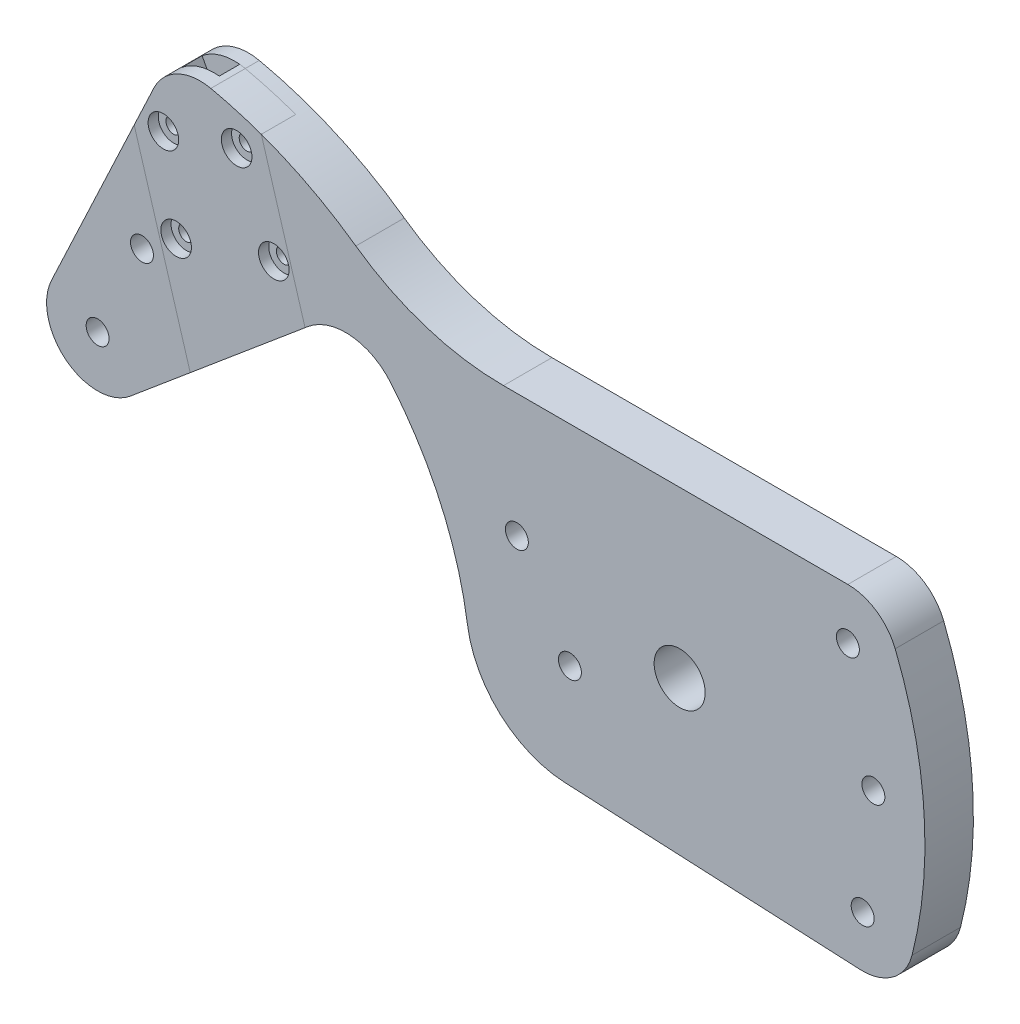
from build123d import *

# Parameters (mm, degrees)
SKETCH1_R              = 2.25
SKETCH1_R_2            = 5
BOSS_EXTRUDE1_DEPTH    = 4.75
CUT_EXTRUDE1_DEPTH     = 2
SKETCH4_R              = 1.5
CUT_EXTRUDE2_DEPTH     = 136.849086626
SKETCH5_R              = 3
CUT_EXTRUDE3_DEPTH     = 2
SPLIT3_SURFACE_1_BACK  = 193.818
SPLIT3_SURFACE_1_DEPTH = 387.636
SPLIT3_SURFACE_2_BACK  = 193.818
SPLIT3_SURFACE_2_DEPTH = 387.636


with BuildPart() as part:
    # Sketch1 → Boss-Extrude1 (new, symmetric)
    with BuildSketch(Plane.XY):
        with BuildLine():
            Line((-22.500230832, -28.983987123), (35.398437983, -31.788291003))
            ThreePointArc((35.398437983, -31.788291003), (41.825152283, -29.842482755), (45.572267137, -24.270413418))
            ThreePointArc((45.572267137, -24.270413418), (47.922199842, 1.185089324), (42.266415188, 26.115330067))
            ThreePointArc((42.266415188, 26.115330067), (38.587871094, 30.681102), (32.982217728, 32.4))
            Line((32.982217728, 32.4), (-34.53815208, 32.4))
            ThreePointArc((-34.53815208, 32.4), (-49.730929753, 34.764094355), (-63.487021029, 41.632819737))
            ThreePointArc((-63.487021029, 41.632819737), (-77.067258547, 49.344582351), (-91.918742124, 54.174444589))
            ThreePointArc((-91.918742124, 54.174444589), (-98.466295495, 53.366674665), (-103.085929893, 48.656905518))
            Line((-103.085929893, 48.656905518), (-123.167077545, 5.955614534))
            ThreePointArc((-123.167077545, 5.955614534), (-120.218280198, -6.2236308), (-107.689906175, -5.960444431))
            Line((-107.689906175, -5.960444431), (-72.864818345, 23.261273923))
            ThreePointArc((-72.864818345, 23.261273923), (-64.470178387, 25.908093735), (-56.662687309, 21.843771132))
            ThreePointArc((-56.662687309, 21.843771132), (-46.809939593, 6.135423294), (-41.608278072, -11.662653759))
            ThreePointArc((-41.608278072, -11.662653759), (-35.156858245, -23.745961099), (-22.500230832, -28.983987123))
        make_face()
        with Locations((35.882217728, -21.8)):
            Circle(SKETCH1_R, mode=Mode.SUBTRACT)
        with Locations((-21.517782272, -8.7)):
            Circle(SKETCH1_R, mode=Mode.SUBTRACT)
        Circle(SKETCH1_R_2, mode=Mode.SUBTRACT)
        with Locations((-31.917782272, 8.2)):
            Circle(SKETCH1_R, mode=Mode.SUBTRACT)
        with Locations((37.982217728, -0.1)):
            Circle(SKETCH1_R, mode=Mode.SUBTRACT)
        with Locations((32.982217728, 22.4)):
            Circle(SKETCH1_R, mode=Mode.SUBTRACT)
        with Locations((-105.417782272, 20.2)):
            Circle(SKETCH1_R, mode=Mode.SUBTRACT)
        with Locations((-114.117782272, 1.7)):
            Circle(SKETCH1_R, mode=Mode.SUBTRACT)
    extrude(amount=BOSS_EXTRUDE1_DEPTH, both=True)

    # Sketch2 → Cut-Extrude1 (cut, symmetric)
    with BuildSketch(Plane.XY):
        with BuildLine():
            Line((-78.227129447, 18.761760655), (-92.084556702, 44.987885053))
            Line((-92.084556702, 44.987885053), (-93.002217677, 54.347646176))
            ThreePointArc((-93.002217677, 54.347646176), (-96.914482214, 53.978242129), (-100.382341665, 52.129939126))
            Line((-100.382341665, 52.129939126), (-95.988712538, 43.814696915))
            Line((-95.988712538, 43.814696915), (-92.369017313, 6.895307763))
            Line((-92.369017313, 6.895307763), (-78.227129447, 18.761760655))
        make_face()
    extrude(amount=CUT_EXTRUDE1_DEPTH, both=True, mode=Mode.SUBTRACT)

    # Sketch4 → Cut-Extrude2 (cut, through all)
    with BuildSketch(Plane.XY.offset(4.75)):
        with Locations((-98.721244854, 25.242626445)):
            Circle(SKETCH4_R)
        with Locations((-101.219347979, 42.242905289)):
            Circle(SKETCH4_R)
        with Locations((-86.853921262, 46.55967668)):
            Circle(SKETCH4_R)
        with Locations((-79.567342565, 30.998321633)):
            Circle(SKETCH4_R)
    extrude(amount=-CUT_EXTRUDE2_DEPTH, mode=Mode.SUBTRACT)

    # Sketch5 → Cut-Extrude3 (cut)
    with BuildSketch(Plane.XY.offset(4.75)):
        with Locations((-101.219347979, 42.242905289)):
            Circle(SKETCH5_R)
        with Locations((-86.853921262, 46.55967668)):
            Circle(SKETCH5_R)
        with Locations((-79.567342565, 30.998321633)):
            Circle(SKETCH5_R)
        with Locations((-98.721244854, 25.242626445)):
            Circle(SKETCH5_R)
    extrude(amount=-CUT_EXTRUDE3_DEPTH, mode=Mode.SUBTRACT)


with BuildPart() as body_2:
    # Split3: the piece behind the surface
    add(part.part)
    # Split3 surface: a surface, the sketch's curves swept straight by 387.636 mm
    with BuildLine(Plane(origin=(-20.02556284, 66.641415389, 0), x_dir=(0.9576951144500195, 0.2877847594271872, 0), z_dir=(-0.2877847594271872, 0.9576951144500195, 0)).offset(-SPLIT3_SURFACE_1_BACK), mode=Mode.PRIVATE) as split3_surface_1_path:
        Line((-63.780410711, -4.75), (-63.780410711, 2))
        Line((-63.780410711, 2), (-90.780410711, 2))
        Line((-90.780410711, 2), (-90.780410711, -4.75))
    split3_surface_1 = Shell.extrude(split3_surface_1_path.wire(), (-0.287784759 * SPLIT3_SURFACE_1_DEPTH, 0.957695114 * SPLIT3_SURFACE_1_DEPTH, 0 * SPLIT3_SURFACE_1_DEPTH))
    split(bisect_by=split3_surface_1, keep=Keep.BOTTOM)


with BuildPart() as part_1:
    add(part.part)

    # Split3: split by a surface, the side it looks to stays
    # Split3 surface: a surface, the sketch's curves swept straight by 387.636 mm
    with BuildLine(Plane(origin=(-20.02556284, 66.641415389, 0), x_dir=(0.9576951144500195, 0.2877847594271872, 0), z_dir=(-0.2877847594271872, 0.9576951144500195, 0)).offset(-SPLIT3_SURFACE_2_BACK), mode=Mode.PRIVATE) as split3_surface_2_path:
        Line((-63.780410711, -4.75), (-63.780410711, 2))
        Line((-63.780410711, 2), (-90.780410711, 2))
        Line((-90.780410711, 2), (-90.780410711, -4.75))
    split3_surface_2 = Shell.extrude(split3_surface_2_path.wire(), (-0.287784759 * SPLIT3_SURFACE_2_DEPTH, 0.957695114 * SPLIT3_SURFACE_2_DEPTH, 0 * SPLIT3_SURFACE_2_DEPTH))
    split(bisect_by=split3_surface_2, keep=Keep.TOP)


solid = Compound([body_2.part, part_1.part])
